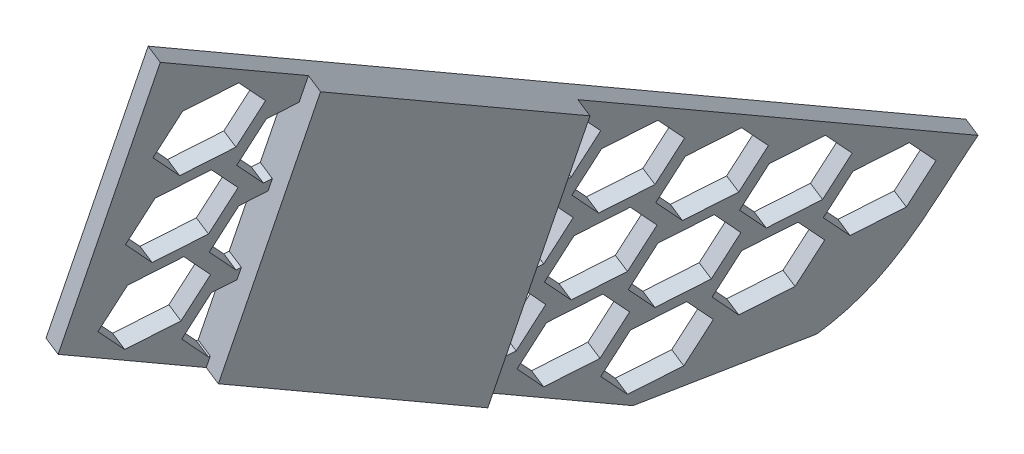
from build123d import *

# Parameters (mm, degrees)
BOSS_EXTRUDE1_DEPTH      = 2
CUT_EXTRUDE2_DEPTH       = 2
FILL_START               = 36.116581205
FILL_PATTERN1_DEPTH      = 2
BOSS_EXTRUDE2_DEPTH      = 2
BOSS_EXTRUDE2_DEPTH_BACK = 2


# Read off the part's stored shape, not the designer's step: Fill Pattern1
with BuildPart() as part:
    # Sketch1 → Boss-Extrude1 (new body)
    with BuildSketch(Plane(origin=(33.669790065, -11.316558939, 6.533618345), x_dir=(0.3075963595688898, 0.9496429323114018, 0.059689033255435724), z_dir=(0.9322529691900319, -0.3133341684384297, 0.1809035663699512))):
        with BuildLine():
            Line((-57.568945453, 121.68686406), (-100.902387075, 51.715943852))
            Line((-100.902387075, 51.715943852), (-100.902387075, 32.254389388))
            add(Edge.make_bspline(
                [(-100.902387075, 32.254389388), (-100.442473357, 31.458808563), (-99.383581078, 29.928136313), (-97.483264926, 27.996228976), (-95.226180551, 26.317886768), (-92.562665334, 24.828690878), (-89.619940932, 23.519356376), (-86.433701886, 22.304158353), (-83.615975501, 21.289615886), (-81.305064927, 20.428782251), (-80.113678401, 19.962997336), (-79.526238835, 19.725091457)],
                knots=[0.001143674, 0.001143674, 0.001143674, 0.001143674, 0.119233579, 0.237323485, 0.35541339, 0.473503295, 0.5915932, 0.709683105, 0.82777301, 0.886817963, 0.945862915, 0.945862915, 0.945862915, 0.945862915], degree=3))
            Line((-79.526238835, 19.725091457), (-17.875333173, 119.273395013))
            Line((-17.875333173, 119.273395013), (-57.568945453, 121.68686406))
        make_face()
    extrude(amount=BOSS_EXTRUDE1_DEPTH)

    # Sketch2 → Cut-Extrude2 (cut)
    with BuildSketch(Plane(origin=(35.534296004, -11.943227276, 6.895425478), x_dir=(0.30759635956877757, 0.9496429323114396, 0.05968903325541397), z_dir=(0.9322529691900542, -0.3133341684383154, 0.18090356637003419))):
        Polygon((-60.882260573, 113.944557721), (-59.845221607, 108.206275442), (-54.357203896, 106.235236392), (-49.906225151, 110.002479621), (-50.943264117, 115.7407619), (-56.431281828, 117.71180095), align=None)
    extrude(amount=-CUT_EXTRUDE2_DEPTH, mode=Mode.SUBTRACT)

    # Fill Pattern1 outline → Fill Pattern1 (cut)
    with BuildSketch(Plane(origin=(0, 0, 0), x_dir=(0.3075963595751989, 0.9496429323114397, 0.05968903322232153), z_dir=(0.9322529691900542, -0.31333416843831513, 0.18090356637003466)).offset(FILL_START)):
        Polygon((-82.988049322, 35.354420584), (-87.439028067, 31.587177355), (-86.4019891, 25.848895075), (-80.913971389, 23.877856025), (-76.462992645, 27.645099254), (-77.500031611, 33.383381534), align=None)
        Polygon((-38.760899761, 106.768419503), (-43.211878505, 103.001176274), (-42.174839539, 97.262893995), (-36.686821828, 95.291854945), (-32.235843083, 99.059098174), (-33.27288205, 104.797380453), align=None)
        Polygon((-50.755172908, 107.139110303), (-55.206151653, 103.371867074), (-54.169112686, 97.633584795), (-48.681094975, 95.662545745), (-44.230116231, 99.429788974), (-45.267155197, 105.168071253), align=None)
        Polygon((-45.079063984, 96.566419658), (-49.530042728, 92.799176429), (-48.493003762, 87.060894149), (-43.004986051, 85.089855099), (-38.554007306, 88.857098328), (-39.591046273, 94.595380608), align=None)
        Polygon((-62.749446055, 107.509801103), (-67.2004248, 103.742557873), (-66.163385834, 98.004275594), (-60.675368123, 96.033236544), (-56.224389378, 99.800479773), (-57.261428344, 105.538762052), align=None)
        Polygon((-44.437008685, 117.341110149), (-48.88798743, 113.573866919), (-47.850948463, 107.83558464), (-42.362930752, 105.86454559), (-37.911952008, 109.631788819), (-38.948990974, 115.370071098), align=None)
        Polygon((-32.442735538, 116.970419349), (-36.893714282, 113.20317612), (-35.856675316, 107.464893841), (-30.368657605, 105.493854791), (-25.91767886, 109.26109802), (-26.954717827, 114.999380299), align=None)
        Polygon((-88.022102947, 66.70180172), (-92.473081692, 62.934558491), (-91.436042726, 57.196276212), (-85.948025015, 55.225237161), (-81.49704627, 58.992480391), (-82.534085236, 64.73076267), align=None)
        Polygon((-70.351720876, 55.758420275), (-74.802699621, 51.991177046), (-73.765660654, 46.252894767), (-68.277642943, 44.281855717), (-63.826664199, 48.049098946), (-64.863703165, 53.787381225), align=None)
        Polygon((-81.703938724, 76.903801566), (-86.154917469, 73.136558336), (-85.117878503, 67.398276057), (-79.629860792, 65.427237007), (-75.178882047, 69.194480236), (-76.215921013, 74.932762515), align=None)
        Polygon((-76.0278298, 66.33111092), (-80.478808545, 62.563867691), (-79.441769579, 56.825585412), (-73.953751868, 54.854546362), (-69.502773123, 58.621789591), (-70.539812089, 64.36007187), align=None)
        Polygon((-94.34026717, 56.499801874), (-98.791245915, 52.732558645), (-97.754206949, 46.994276366), (-92.266189238, 45.023237316), (-87.815210493, 48.790480545), (-88.852249459, 54.528762824), align=None)
        Polygon((-88.664158246, 45.927111229), (-93.115136991, 42.159868), (-92.078098025, 36.421585721), (-86.590080314, 34.450546671), (-82.139101569, 38.2177899), (-83.176140535, 43.956072179), align=None)
        Polygon((-82.345994023, 56.129111075), (-86.796972768, 52.361867846), (-85.759933802, 46.623585566), (-80.271916091, 44.652546516), (-75.820937346, 48.419789745), (-76.857976312, 54.158072025), align=None)
        Polygon((-76.669885099, 45.556420429), (-81.120863844, 41.7891772), (-80.083824877, 36.050894921), (-74.595807166, 34.079855871), (-70.144828422, 37.8470991), (-71.181867388, 43.585381379), align=None)
        Polygon((-69.067610278, 97.307801257), (-73.518589023, 93.540558028), (-72.481550057, 87.802275749), (-66.993532346, 85.831236698), (-62.542553601, 89.598479928), (-63.579592567, 95.336762207), align=None)
        Polygon((-63.391501354, 86.735110612), (-67.842480099, 82.967867383), (-66.805441132, 77.229585103), (-61.317423421, 75.258546053), (-56.866444677, 79.025789282), (-57.903483643, 84.764071561), align=None)
        Polygon((-57.073337131, 96.937110457), (-61.524315876, 93.169867228), (-60.487276909, 87.431584949), (-54.999259198, 85.460545899), (-50.548280454, 89.227789128), (-51.58531942, 94.966071407), align=None)
        Polygon((-51.397228207, 86.364419812), (-55.848206951, 82.597176583), (-54.811167985, 76.858894304), (-49.323150274, 74.887855254), (-44.872171529, 78.655098483), (-45.909210496, 84.393380762), align=None)
        Polygon((-69.709665577, 76.533110766), (-74.160644322, 72.765867537), (-73.123605356, 67.027585258), (-67.635587645, 65.056546208), (-63.1846089, 68.823789437), (-64.221647866, 74.562071716), align=None)
        Polygon((-64.033556653, 65.960420121), (-68.484535398, 62.193176892), (-67.447496431, 56.454894612), (-61.95947872, 54.483855562), (-57.508499976, 58.251098791), (-58.545538942, 63.989381071), align=None)
        Polygon((-75.385774501, 87.105801411), (-79.836753246, 83.338558182), (-78.79971428, 77.600275903), (-73.311696569, 75.629236853), (-68.860717824, 79.396480082), (-69.89775679, 85.134762361), align=None)
        Polygon((-57.71539243, 76.162419966), (-62.166371175, 72.395176737), (-61.129332208, 66.656894458), (-55.641314497, 64.685855408), (-51.190335753, 68.453098637), (-52.227374719, 74.191380916), align=None)
    extrude(amount=FILL_PATTERN1_DEPTH, mode=Mode.SUBTRACT)

    # Sketch3 → Boss-Extrude2 (add, two sides: drawn at the far end of the back side and taken through both)
    with BuildSketch(Plane(origin=(35.534296004, -11.943227276, 6.895425478), x_dir=(0.3075963595751957, 0.9496429323114406, 0.05968903322232247), z_dir=(0.9322529691900543, -0.31333416843831224, 0.1809035663700394)).offset(-BOSS_EXTRUDE2_DEPTH_BACK)):
        Polygon((-68.737584877, 103.652755792), (-29.043972597, 101.239286747), (-49.359262726, 68.435994613), (-89.052875005, 70.849463659), align=None)
    extrude(amount=BOSS_EXTRUDE2_DEPTH + BOSS_EXTRUDE2_DEPTH_BACK)


solid = part.part
